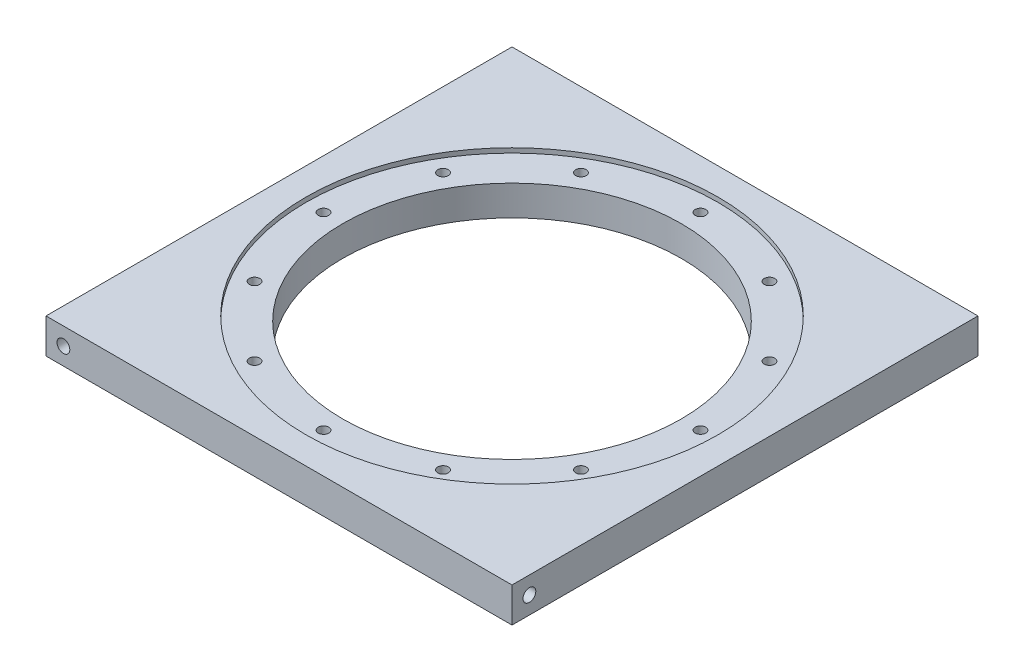
from build123d import *

# Parameters (mm, degrees)
SKETCH1_W           = 127.635
SKETCH1_H           = 127.635
BOSS_EXTRUDE1_DEPTH = 9.525
CUT_EXTRUDE1_DEPTH  = 9.525
SKETCH6_R           = 1.7526
F_6_32_HOLE1_DEPTH  = 6.35
SKETCH7_R           = 1.7526
F_6_32_HOLE2_DEPTH  = 6.35
SKETCH8_R           = 1.7526
F_6_32_HOLE3_DEPTH  = 6.35
SKETCH9_R           = 1.7526
F_6_32_HOLE4_DEPTH  = 6.35
SKETCH11_R          = 1.4351
CUT_EXTRUDE3_DEPTH  = 181.754286464
CIRPATTERN1_COUNT   = 12
SKETCH12_R          = 56.41975
CUT_EXTRUDE4_DEPTH  = 1.27


with BuildPart() as part:
    # Sketch1 → Boss-Extrude1 (new body)
    with BuildSketch(Plane(origin=(0, 0, 0), x_dir=(1, 0, 0), z_dir=(0, 1, 0))):
        with Locations((63.8175, 63.8175)):
            Rectangle(SKETCH1_W, SKETCH1_H)
    extrude(amount=BOSS_EXTRUDE1_DEPTH)

    # Sketch5 → Cut-Extrude1 (cut)
    with BuildSketch(Plane(origin=(0, 9.525, 0), x_dir=(1, 0, 0), z_dir=(0, 1, 0))):
        with BuildLine():
            ThreePointArc((63.8175, 110.1725), (17.4625, 63.8175), (63.8175, 17.4625))
            Line((63.8175, 17.4625), (63.8175, 110.1725))
        make_face()
        with BuildLine():
            Line((63.8175, 110.1725), (63.8175, 17.4625))
            ThreePointArc((63.8175, 17.4625), (96.595434842, 31.039565158), (110.1725, 63.8175))
            ThreePointArc((110.1725, 63.8175), (96.595434842, 96.595434842), (63.8175, 110.1725))
        make_face()
        with BuildLine():
            ThreePointArc((63.8175, 110.1725), (17.4625, 63.8175), (63.8175, 17.4625))
            Line((63.8175, 17.4625), (63.8175, 110.1725))
        make_face()
        with BuildLine():
            Line((63.8175, 110.1725), (63.8175, 17.4625))
            ThreePointArc((63.8175, 17.4625), (96.595434842, 31.039565158), (110.1725, 63.8175))
            ThreePointArc((110.1725, 63.8175), (96.595434842, 96.595434842), (63.8175, 110.1725))
        make_face()
    extrude(amount=-CUT_EXTRUDE1_DEPTH, mode=Mode.SUBTRACT)

    # Sketch6 → 6-32 hole1 (cut)
    with BuildSketch(Plane(origin=(127.635, 0, 0), x_dir=(0, 0, -1), z_dir=(1, 0, 0))):
        with Locations((4.7625, 4.7625)):
            Circle(SKETCH6_R)
    extrude(amount=-F_6_32_HOLE1_DEPTH, mode=Mode.SUBTRACT)

    # Sketch7 → 6-32 hole2 (cut)
    with BuildSketch(Plane(origin=(0, 0, -127.635), x_dir=(-1, 0, 0), z_dir=(0, 0, -1))):
        with Locations((-122.8725, 4.7625)):
            Circle(SKETCH7_R)
    extrude(amount=-F_6_32_HOLE2_DEPTH, mode=Mode.SUBTRACT)

    # Sketch8 → 6-32 hole3 (cut)
    with BuildSketch(Plane.ZY):
        with Locations((-122.8725, 4.7625)):
            Circle(SKETCH8_R)
    extrude(amount=-F_6_32_HOLE3_DEPTH, mode=Mode.SUBTRACT)

    # Sketch9 → 6-32 hole4 (cut)
    with BuildSketch(Plane.XY):
        with Locations((4.7625, 4.7625)):
            Circle(SKETCH9_R)
    extrude(amount=-F_6_32_HOLE4_DEPTH, mode=Mode.SUBTRACT)

    # Sketch11 → Cut-Extrude3 (cut, through all)
    with BuildSketch(Plane(origin=(0, 9.525, 0), x_dir=(1, 0, 0), z_dir=(0, 1, 0))):
        with Locations((63.8175, 115.443)):
            Circle(SKETCH11_R)
    cut_extrude3 = extrude(amount=-CUT_EXTRUDE3_DEPTH, mode=Mode.SUBTRACT)

    # CirPattern1: Cut-Extrude3 ×12 about axis
    cirpattern1_axis = Axis((63.8175, 9.525, -63.8175), (0, 1, 0))
    for i in range(1, CIRPATTERN1_COUNT):
        add(cut_extrude3.rotate(cirpattern1_axis, i * 360 / CIRPATTERN1_COUNT), mode=Mode.SUBTRACT)

    # Sketch12 → Cut-Extrude4 (cut)
    with BuildSketch(Plane(origin=(0, 9.525, 0), x_dir=(1, 0, 0), z_dir=(0, 1, 0))):
        with Locations((63.8175, 63.8175)):
            Circle(SKETCH12_R)
    extrude(amount=-CUT_EXTRUDE4_DEPTH, mode=Mode.SUBTRACT)


solid = part.part
